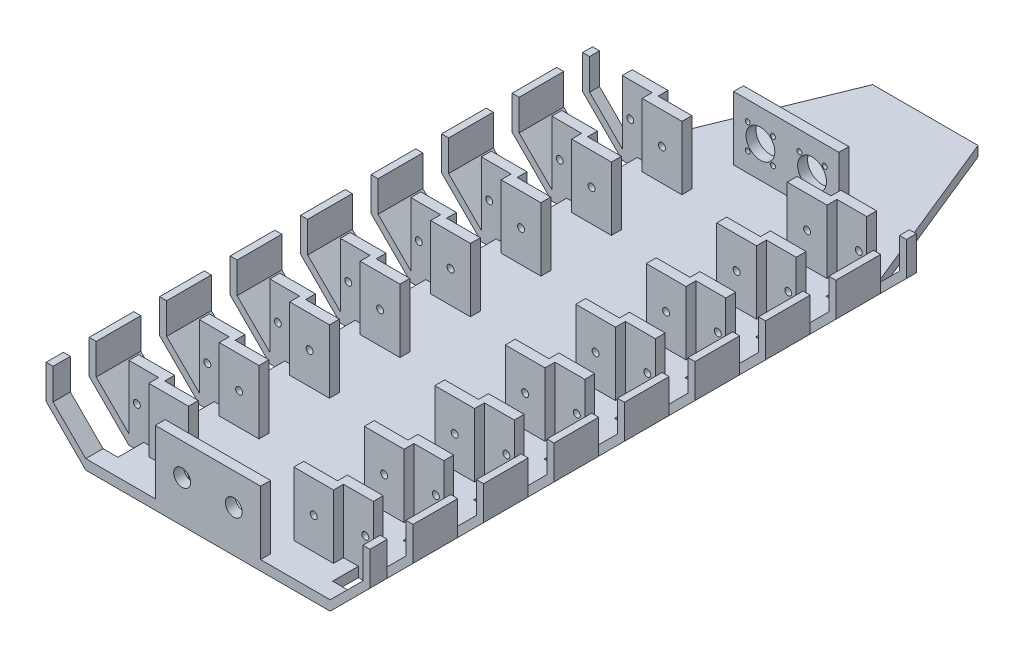
from build123d import *

# Parameters (mm, degrees)
BOSS_EXTRUDE1_DEPTH     = 5
SKETCH2_W               = 123
SKETCH2_H               = 5
BOSS_EXTRUDE2_DEPTH     = 32
SKETCH9_W               = 123
SKETCH9_H               = 5
BOSS_EXTRUDE4_DEPTH     = 5
SKETCH10_W              = 18
SKETCH10_H              = 5
BOSS_EXTRUDE8_DEPTH     = 32
BOSS_EXTRUDE9_DEPTH     = 32
CUT_EXTRUDE4_DEPTH      = 250
CUT_EXTRUDE4_DEPTH_BACK = 32
SKETCH8_R               = 1.75
SKETCH13_W              = 35
SKETCH13_H              = 32
CUT_EXTRUDE5_DEPTH      = 11
BOSS_EXTRUDE10_DEPTH    = 275
CUT_EXTRUDE6_DEPTH      = 166.124952687
CUT_EXTRUDE6_DEPTH_BACK = 166.124952687
SKETCH15_W              = 27.5
SKETCH15_H              = 13
CUT_EXTRUDE7_DEPTH      = 269.643183488
CUT_EXTRUDE7_DEPTH_BACK = 269.643183488
SKETCH16_R              = 1.75
BOSS_EXTRUDE13_DEPTH    = 5
SKETCH18_W              = 53
SKETCH18_H              = 5
BOSS_EXTRUDE14_DEPTH    = 32
SKETCH3_R               = 4.25
CUT_EXTRUDE8_DEPTH      = 334
SKETCH19_R              = 7.25
SKETCH19_R_2            = 1.25
CUT_EXTRUDE9_DEPTH      = 334


with BuildPart() as part:
    # Sketch1 → Boss-Extrude1 (new body)
    with BuildSketch(Plane(origin=(0, 0, 0), x_dir=(1, 0, 0), z_dir=(0, 1, 0))):
        Polygon((-13, 135), (-36, 135), (-61.5, 135), (-61.5, -135), (-36, -135), (-13, -135), (13, -135), (36, -135), (61.5, -135), (61.5, 135), (36, 135), (13, 135), align=None)
    extrude(amount=BOSS_EXTRUDE1_DEPTH)

    # Sketch2 → Boss-Extrude2 (add)
    with BuildSketch(Plane(origin=(0, 5, 0), x_dir=(1, 0, 0), z_dir=(0, 1, 0))):
        with Locations((0, -132.5)):
            Rectangle(SKETCH2_W, SKETCH2_H)
        Polygon((-36.5, 135), (-26.5, 135), (-26.5, 130), (-46.5, 130), (-46.5, 135), align=None)
        Polygon((46.5, 130), (26.5, 130), (26.5, 135), (36.5, 135), (46.5, 135), align=None)
    extrude(amount=BOSS_EXTRUDE2_DEPTH)

    # Sketch9 → Boss-Extrude4 (add)
    with BuildSketch(Plane(origin=(0, 0, -135), x_dir=(-1, 0, 0), z_dir=(0, 0, -1))):
        with Locations((0, 2.5)):
            Rectangle(SKETCH9_W, SKETCH9_H)
    extrude(amount=BOSS_EXTRUDE4_DEPTH)

    # Sketch10 → Boss-Extrude8 (add)
    with BuildSketch(Plane(origin=(0, 5, 0), x_dir=(1, 0, 0), z_dir=(0, 1, 0))):
        with Locations((-52.5, 137.5)):
            Rectangle(SKETCH10_W, SKETCH10_H)
        with Locations((52.5, 137.5)):
            Rectangle(SKETCH10_W, SKETCH10_H)
    extrude(amount=BOSS_EXTRUDE8_DEPTH)

    # Sketch11 → Boss-Extrude9 (add)
    with BuildSketch(Plane(origin=(0, 5, 0), x_dir=(1, 0, 0), z_dir=(0, 1, 0))):
        Polygon((-46.5, -118.294117647), (-26.5, -118.294117647), (-26.5, -113.294117647), (-43.5, -113.294117647), (-43.5, -108.294117647), (-61.5, -108.294117647), (-61.5, -113.294117647), (-46.5, -113.294117647), align=None)
        Polygon((-61.5, 104.529411765), (-61.5, 99.529411765), (-46.5, 99.529411765), (-46.5, 94.529411765), (-26.5, 94.529411765), (-26.5, 99.529411765), (-43.5, 99.529411765), (-43.5, 104.529411765), align=None)
        Polygon((-61.5, 69.058823529), (-61.5, 64.058823529), (-46.5, 64.058823529), (-46.5, 59.058823529), (-26.5, 59.058823529), (-26.5, 64.058823529), (-43.5, 64.058823529), (-43.5, 69.058823529), align=None)
        Polygon((-61.5, 33.588235294), (-61.5, 28.588235294), (-46.5, 28.588235294), (-46.5, 23.588235294), (-26.5, 23.588235294), (-26.5, 28.588235294), (-43.5, 28.588235294), (-43.5, 33.588235294), align=None)
        Polygon((-61.5, -1.882352941), (-61.5, -6.882352941), (-46.5, -6.882352941), (-46.5, -11.882352941), (-26.5, -11.882352941), (-26.5, -6.882352941), (-43.5, -6.882352941), (-43.5, -1.882352941), align=None)
        Polygon((-61.5, -37.352941176), (-61.5, -42.352941176), (-46.5, -42.352941176), (-46.5, -47.352941176), (-26.5, -47.352941176), (-26.5, -42.352941176), (-43.5, -42.352941176), (-43.5, -37.352941176), align=None)
        Polygon((-61.5, -72.823529412), (-61.5, -77.823529412), (-46.5, -77.823529412), (-46.5, -82.823529412), (-26.5, -82.823529412), (-26.5, -77.823529412), (-43.5, -77.823529412), (-43.5, -72.823529412), align=None)
        Polygon((46.5, 99.529411765), (61.5, 99.529411765), (61.5, 104.529411765), (43.5, 104.529411765), (43.5, 99.529411765), (26.5, 99.529411765), (26.5, 94.529411765), (46.5, 94.529411765), align=None)
        Polygon((46.5, 64.058823529), (61.5, 64.058823529), (61.5, 69.058823529), (43.5, 69.058823529), (43.5, 64.058823529), (26.5, 64.058823529), (26.5, 59.058823529), (46.5, 59.058823529), align=None)
        Polygon((46.5, 28.588235294), (61.5, 28.588235294), (61.5, 33.588235294), (43.5, 33.588235294), (43.5, 28.588235294), (26.5, 28.588235294), (26.5, 23.588235294), (46.5, 23.588235294), align=None)
        Polygon((46.5, -6.882352941), (61.5, -6.882352941), (61.5, -1.882352941), (43.5, -1.882352941), (43.5, -6.882352941), (26.5, -6.882352941), (26.5, -11.882352941), (46.5, -11.882352941), align=None)
        Polygon((46.5, -42.352941176), (61.5, -42.352941176), (61.5, -37.352941176), (43.5, -37.352941176), (43.5, -42.352941176), (26.5, -42.352941176), (26.5, -47.352941176), (46.5, -47.352941176), align=None)
        Polygon((46.5, -77.823529412), (61.5, -77.823529412), (61.5, -72.823529412), (43.5, -72.823529412), (43.5, -77.823529412), (26.5, -77.823529412), (26.5, -82.823529412), (46.5, -82.823529412), align=None)
        Polygon((43.5, -108.294117647), (43.5, -113.294117647), (26.5, -113.294117647), (26.5, -118.294117647), (46.5, -118.294117647), (46.5, -113.294117647), (61.5, -113.294117647), (61.5, -108.294117647), align=None)
    extrude(amount=BOSS_EXTRUDE9_DEPTH)

    # Sketch8 → Cut-Extrude4 (cut, two sides: drawn at the far end of the back side and taken through both)
    with BuildSketch(Plane.XY.offset(-130).offset(-CUT_EXTRUDE4_DEPTH_BACK)):
        with Locations((-36.5, 21)):
            Circle(SKETCH8_R)
        with Locations((36.5, 21)):
            Circle(SKETCH8_R)
    extrude(amount=CUT_EXTRUDE4_DEPTH + CUT_EXTRUDE4_DEPTH_BACK, mode=Mode.SUBTRACT)

    # Sketch13 → Cut-Extrude5 (cut)
    with BuildSketch(Plane.XY.offset(135)):
        with Locations((-44, 21)):
            Rectangle(SKETCH13_W, SKETCH13_H)
        with Locations((44, 21)):
            Rectangle(SKETCH13_W, SKETCH13_H)
    extrude(amount=-CUT_EXTRUDE5_DEPTH, mode=Mode.SUBTRACT)

    # Sketch14 → Boss-Extrude10 (add)
    with BuildSketch(Plane.XY.offset(135)):
        Polygon((-61.5, 0), (-81.5, 20), (-81.5, 37), (-77.96, 37), (-77.96, 21.46), (-61.5, 5), align=None)
        Polygon((77.96, 37), (77.96, 21.46), (61.5, 5), (61.5, 0), (81.5, 20), (81.5, 37), align=None)
    extrude(amount=-BOSS_EXTRUDE10_DEPTH)

    # Sketch15 → Cut-Extrude6 (cut, two sides: drawn at the far end of the back side and taken through both)
    with BuildSketch(Plane(origin=(0, 5, 0), x_dir=(1, 0, 0), z_dir=(0, 1, 0)).offset(-CUT_EXTRUDE6_DEPTH_BACK)):
        with Locations((-67.75, 128.5)):
            Rectangle(SKETCH15_W, SKETCH15_H)
        with Locations((-67.75, 93.029411765)):
            Rectangle(SKETCH15_W, SKETCH15_H)
        with Locations((-67.75, 57.558823529)):
            Rectangle(SKETCH15_W, SKETCH15_H)
        with Locations((-67.75, 22.088235294)):
            Rectangle(SKETCH15_W, SKETCH15_H)
        with Locations((-67.75, -13.382352941)):
            Rectangle(SKETCH15_W, SKETCH15_H)
        with Locations((-67.75, -48.852941176)):
            Rectangle(SKETCH15_W, SKETCH15_H)
        with Locations((-67.75, -84.323529412)):
            Rectangle(SKETCH15_W, SKETCH15_H)
        with Locations((-67.75, -119.794117647)):
            Rectangle(SKETCH15_W, SKETCH15_H)
        with Locations((67.75, -119.794117647)):
            Rectangle(SKETCH15_W, SKETCH15_H)
        with Locations((67.75, -84.323529412)):
            Rectangle(SKETCH15_W, SKETCH15_H)
        with Locations((67.75, -48.852941176)):
            Rectangle(SKETCH15_W, SKETCH15_H)
        with Locations((67.75, -13.382352941)):
            Rectangle(SKETCH15_W, SKETCH15_H)
        with Locations((67.75, 22.088235294)):
            Rectangle(SKETCH15_W, SKETCH15_H)
        with Locations((67.75, 57.558823529)):
            Rectangle(SKETCH15_W, SKETCH15_H)
        with Locations((67.75, 93.029411765)):
            Rectangle(SKETCH15_W, SKETCH15_H)
        with Locations((67.75, 128.5)):
            Rectangle(SKETCH15_W, SKETCH15_H)
    extrude(amount=CUT_EXTRUDE6_DEPTH + CUT_EXTRUDE6_DEPTH_BACK, mode=Mode.SUBTRACT)

    # Sketch16 → Cut-Extrude7 (cut, two sides: drawn at the far end of the back side and taken through both)
    with BuildSketch(Plane.XY.offset(113.294117647).offset(-CUT_EXTRUDE7_DEPTH_BACK)):
        with Locations((-57.5, 20)):
            Circle(SKETCH16_R)
        with Locations((57.5, 20)):
            Circle(SKETCH16_R)
    extrude(amount=CUT_EXTRUDE7_DEPTH + CUT_EXTRUDE7_DEPTH_BACK, mode=Mode.SUBTRACT)

    # Sketch17 → Boss-Extrude13 (add)
    with BuildSketch(Plane(origin=(0, 5, 0), x_dir=(1, 0, 0), z_dir=(0, 1, 0))):
        Polygon((-61.5, 140), (-26.5, 226), (0, 226), (26.5, 226), (61.5, 140), align=None)
    extrude(amount=-BOSS_EXTRUDE13_DEPTH)

    # Sketch18 → Boss-Extrude14 (add)
    with BuildSketch(Plane(origin=(0, 5, 0), x_dir=(1, 0, 0), z_dir=(0, 1, 0))):
        with Locations((0, 158.5)):
            Rectangle(SKETCH18_W, SKETCH18_H)
    extrude(amount=BOSS_EXTRUDE14_DEPTH)

    # Sketch3 → Cut-Extrude8 (cut)
    with BuildSketch(Plane.XY.offset(135)):
        with Locations((-13, 21)):
            Circle(SKETCH3_R)
        with Locations((13, 21)):
            Circle(SKETCH3_R)
    extrude(amount=-CUT_EXTRUDE8_DEPTH, mode=Mode.SUBTRACT)

    # Sketch19 → Cut-Extrude9 (cut)
    with BuildSketch(Plane.XY.offset(-156)):
        with Locations((-13, 21)):
            Circle(SKETCH19_R)
        with Locations((-6.636038969, 14.636038969)):
            Circle(SKETCH19_R_2)
        with Locations((-6.636038969, 27.363961031)):
            Circle(SKETCH19_R_2)
        with Locations((-19.363961031, 27.363961031)):
            Circle(SKETCH19_R_2)
        with Locations((-19.363961031, 14.636038969)):
            Circle(SKETCH19_R_2)
        with Locations((13, 21)):
            Circle(SKETCH19_R)
        with Locations((19.363961031, 14.636038969)):
            Circle(SKETCH19_R_2)
        with Locations((6.636038969, 14.636038969)):
            Circle(SKETCH19_R_2)
        with Locations((6.636038969, 27.363961031)):
            Circle(SKETCH19_R_2)
        with Locations((19.363961031, 27.363961031)):
            Circle(SKETCH19_R_2)
    extrude(amount=-CUT_EXTRUDE9_DEPTH, mode=Mode.SUBTRACT)


solid = part.part
